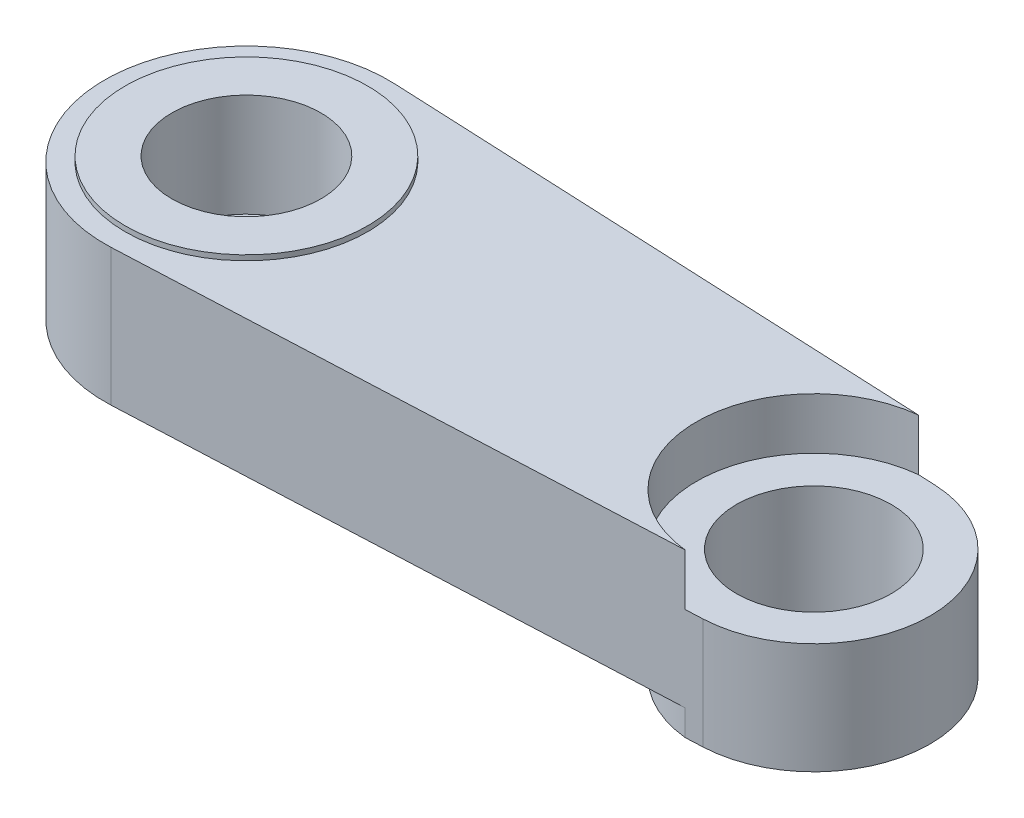
from build123d import *
from build123d.topology import SkipClean

# Parameters (mm, degrees)
SKETCH1_R               = 1.5
SKETCH1_R_2             = 3
BOSS_EXTRUDE1_DEPTH     = 3.5
SKETCH2_R               = 4.7
SKETCH2_R_2             = 2.89
BOSS_EXTRUDE2_DEPTH     = 3
CUT_EXTRUDE1_START      = -1
SKETCH3_R               = 2.89
CUT_EXTRUDE1_DEPTH      = 1
SKETCH4_R               = 3
SKETCH4_R_2             = 4.7
BOSS_EXTRUDE3_DEPTH     = 1.8
CUT_EXTRUDE2_DEPTH      = 1
BOSS_EXTRUDE4_OUTLINE_R = 4.7
BOSS_EXTRUDE4_DEPTH     = 1
CUT_EXTRUDE3_START      = -1
SKETCH7_R               = 3
CUT_EXTRUDE3_DEPTH      = 1
BOSS_EXTRUDE5_START     = -5.3
SKETCH7_2_R             = 3
BOSS_EXTRUDE5_DEPTH     = 1


# Read off the part's stored shape, not the designer's step: Boss-Extrude4
with BuildPart() as part:
    # Sketch1 → Boss-Extrude1 (new body)
    with BuildSketch(Plane(origin=(0, 0, 0), x_dir=(1, 0, 0), z_dir=(0, 1, 0))):
        with BuildLine():
            Line((0.25, 5.494315244), (22.204545455, 4.495348836))
            ThreePointArc((22.204545455, 4.495348836), (26.5, 0), (22.204545455, -4.495348836))
            Line((22.204545455, -4.495348836), (0.25, -5.494315244))
            ThreePointArc((0.25, -5.494315244), (-5.5, 0), (0.25, 5.494315244))
        make_face()
        with Locations(Location((0, 0, 0), (0, 0, 270))):
            Circle(SKETCH1_R, mode=Mode.SUBTRACT)
        with Locations(Location((22, 0, 0), (0, 0, 270))):
            Circle(SKETCH1_R_2, mode=Mode.SUBTRACT)
    extrude(amount=BOSS_EXTRUDE1_DEPTH)

    # Sketch2 → Boss-Extrude2 (add)
    with BuildSketch(Plane(origin=(0, 3.5, 0), x_dir=(1, 0, 0), z_dir=(0, 1, 0))):
        with Locations(Location((0, 0, 0), (0, 0, 90))):
            Circle(SKETCH2_R)
        with Locations(Location((0, 0, 0), (0, 0, 270))):
            Circle(SKETCH2_R_2, mode=Mode.SUBTRACT)
    extrude(amount=BOSS_EXTRUDE2_DEPTH)

    # Sketch3 → Cut-Extrude1 (cut)
    with BuildSketch(Plane(origin=(0, 3.5, 0), x_dir=(1, 0, 0), z_dir=(0, 1, 0)).offset(CUT_EXTRUDE1_START)):
        with Locations(Location((0, 0, 0), (0, 0, 270))):
            Circle(SKETCH3_R)
    extrude(amount=CUT_EXTRUDE1_DEPTH, mode=Mode.SUBTRACT)

    # Sketch4 → Boss-Extrude3 (add)
    with SkipClean():  # the faces are left unmerged after this step: merging them gives an invalid solid
        with BuildSketch(Plane(origin=(0, 3.5, 0), x_dir=(1, 0, 0), z_dir=(0, 1, 0))):
            with BuildLine():
                Line((0.25, -5.494315244), (22.204545455, -4.495348836))
                ThreePointArc((22.204545455, -4.495348836), (26.5, 0), (22.204545455, 4.495348836))
                Line((22.204545455, 4.495348836), (0.25, 5.494315244))
                ThreePointArc((0.25, 5.494315244), (-5.5, 0), (0.25, -5.494315244))
            make_face()
            with Locations(Location((22, 0, 0), (0, 0, 270))):
                Circle(SKETCH4_R, mode=Mode.SUBTRACT)
            with Locations(Location((0, 0, 0), (0, 0, 270))):
                Circle(SKETCH4_R_2, mode=Mode.SUBTRACT)
        extrude(amount=BOSS_EXTRUDE3_DEPTH)

    # Sketch5 → Cut-Extrude2 (cut)
    with SkipClean():  # the faces are left unmerged after this step: merging them gives an invalid solid
        with BuildSketch(Plane.XZ):
            with BuildLine():
                Line((22.204545455, 4.495348836), (0.25, 5.494315244))
                ThreePointArc((0.25, 5.494315244), (-5.5, 0), (0.25, -5.494315244))
                Line((0.25, -5.494315244), (22.204545455, -4.495348836))
                ThreePointArc((22.204545455, -4.495348836), (26.5, 0), (22.204545455, 4.495348836))
            make_face()
        extrude(amount=-CUT_EXTRUDE2_DEPTH, mode=Mode.SUBTRACT)

    # Boss-Extrude4 outline → Boss-Extrude4 (add)
    with SkipClean():  # the faces are left unmerged after this step: merging them gives an invalid solid
        with BuildSketch(Plane(origin=(0, 5.3, 0), x_dir=(1, 0, 0), z_dir=(0, 1, 0))):
            with BuildLine():
                ThreePointArc((21.53255953, -4.525925254), (17.45, 0), (21.53255953, 4.525925254))
                Line((21.53255953, 4.525925254), (0.25, 5.494315244))
                ThreePointArc((0.25, 5.494315244), (-5.5, 0), (0.25, -5.494315244))
                Line((0.25, -5.494315244), (21.53255953, -4.525925254))
            make_face()
            Circle(BOSS_EXTRUDE4_OUTLINE_R, mode=Mode.SUBTRACT)
        extrude(amount=BOSS_EXTRUDE4_DEPTH)

    # Sketch7 → Cut-Extrude3 (cut)
    with SkipClean():  # the faces are left unmerged after this step: merging them gives an invalid solid
        with BuildSketch(Plane(origin=(0, 5.3, 0), x_dir=(1, 0, 0), z_dir=(0, 1, 0)).offset(CUT_EXTRUDE3_START)):
            with BuildLine():
                Line((22.204545455, 4.495348836), (21.53255953, 4.525925254))
                ThreePointArc((21.53255953, 4.525925254), (17.45, 0), (21.53255953, -4.525925254))
                Line((21.53255953, -4.525925254), (22.204545455, -4.495348836))
                ThreePointArc((22.204545455, -4.495348836), (26.5, 0), (22.204545455, 4.495348836))
            make_face()
            with Locations(Location((22, 0, 0), (0, 0, 90))):
                Circle(SKETCH7_R, mode=Mode.SUBTRACT)
        extrude(amount=CUT_EXTRUDE3_DEPTH, mode=Mode.SUBTRACT)

    # Sketch7<2> → Boss-Extrude5 (add)
    with SkipClean():  # the faces are left unmerged after this step: merging them gives an invalid solid
        with BuildSketch(Plane(origin=(0, 5.3, 0), x_dir=(1, 0, 0), z_dir=(0, 1, 0)).offset(BOSS_EXTRUDE5_START)):
            with BuildLine():
                Line((22.204545455, 4.495348836), (21.53255953, 4.525925254))
                ThreePointArc((21.53255953, 4.525925254), (17.45, 0), (21.53255953, -4.525925254))
                Line((21.53255953, -4.525925254), (22.204545455, -4.495348836))
                ThreePointArc((22.204545455, -4.495348836), (26.5, 0), (22.204545455, 4.495348836))
            make_face()
            with Locations(Location((22, 0, 0), (0, 0, 90))):
                Circle(SKETCH7_2_R, mode=Mode.SUBTRACT)
        extrude(amount=BOSS_EXTRUDE5_DEPTH)


solid = part.part
